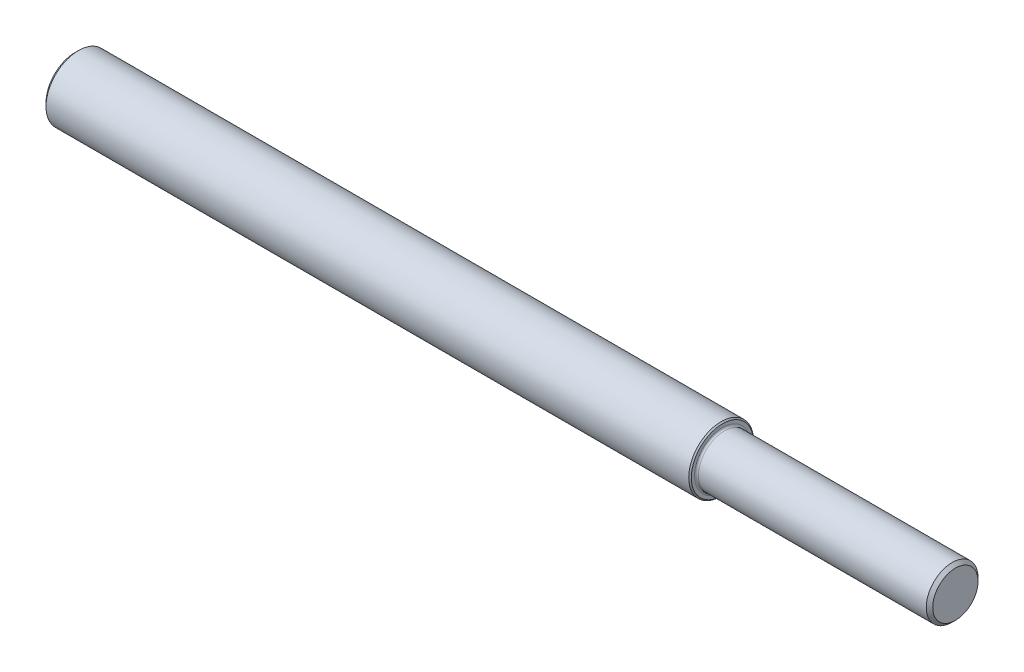
from build123d import *


with BuildPart() as part:
    # Sketch1 → Revolve1 (revolve)
    with BuildSketch(Plane.XY):
        with BuildLine():
            Line((0, 0), (0, 4.5))
            Line((0, 4.5), (0.5, 5))
            Line((0.5, 5), (99.8, 5))
            Line((99.8, 5), (100, 4.8))
            Line((100, 4.8), (100, 4.3))
            ThreePointArc((100, 4.3), (100.087867966, 4.087867966), (100.3, 4))
            Line((100.3, 4), (135.5, 4))
            Line((135.5, 4), (136, 3.5))
            Line((136, 3.5), (136, 0))
            Line((136, 0), (0, 0))
        make_face()
    revolve(axis=Axis((136, 0, 0), (-1, 0, 0)))


solid = part.part
